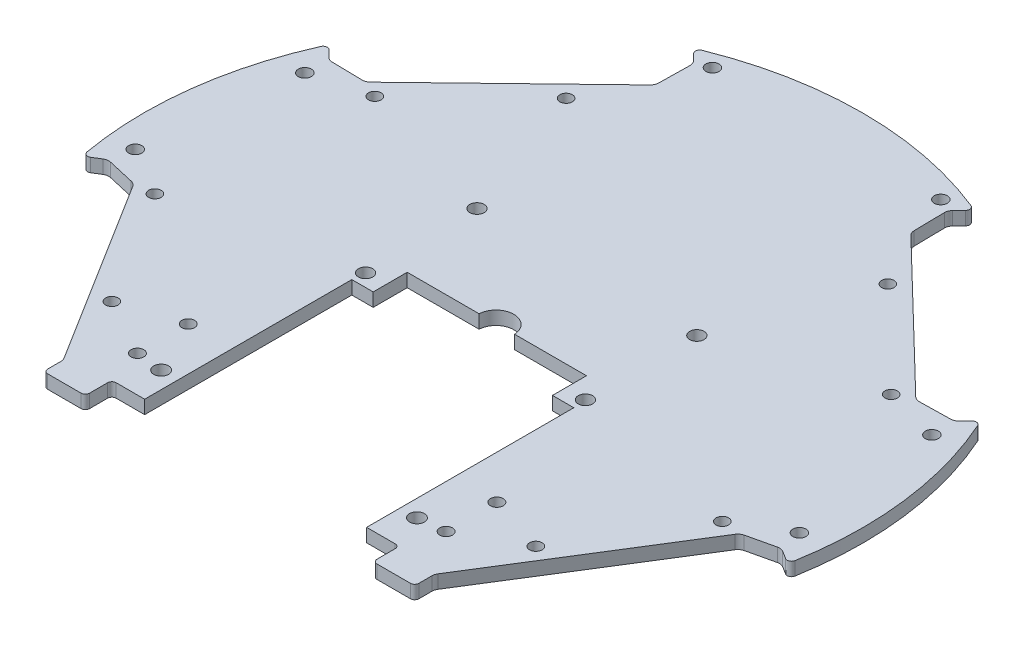
from build123d import *

# Parameters (mm, degrees)
BOSS_EXTRUDE4_DEPTH  = 1.5875
M3_CLEARANCE_HOLE3_D = 3
M3_CLEARANCE_HOLE1_D = 3.1
M3_CLEARANCE_HOLE4_D = 2.95
M3_CLEARANCE_HOLE2_D = 3.1
BOSS_EXTRUDE6_DEPTH  = 3.175
FILLET1_R            = 2
FILLET3_R            = 1
FILLET6_R            = 0.5
CUT_EXTRUDE4_DEPTH   = 10
SKETCH29_R           = 1.75
CUT_EXTRUDE5_DEPTH   = 10
SKETCH31_R           = 1.7
CUT_EXTRUDE7_DEPTH   = 10


with BuildPart() as part:
    # Sketch1 → Boss-Extrude4 (new, symmetric)
    with BuildSketch(Plane(origin=(0, 0, 0), x_dir=(1, 0, 0), z_dir=(0, 1, 0))):
        with BuildLine():
            Line((-62.799553621, 32.496136604), (-73.969425011, 32.691107434))
            Line((-73.969425011, 32.691107434), (-77.053684287, 35.88495141))
            ThreePointArc((-77.053684287, 35.88495141), (-84.36642289, 10.358894189), (-83.446216027, -16.178041625))
            Line((-83.446216027, -16.178041625), (-79.680911643, -13.825218315))
            Line((-79.680911643, -13.825218315), (-69.484649137, -16.179210996))
            Line((-69.484649137, -16.179210996), (-43.894490772, -57.132025032))
            Line((-43.894490772, -57.132025032), (-43.894490772, -64.826600275))
            Line((-43.894490772, -64.826600275), (-43.094490772, -64.826600275))
            Line((-43.094490772, -64.826600275), (-34, -64.826600275))
            Line((-34, -64.826600275), (-34, -59.55))
            Line((-34, -59.55), (-34, -58.55))
            Line((-34, -58.55), (-20, -58.55))
            Line((-20, -58.55), (-19.859459165, -59.55))
            Line((-19.859459165, -59.55), (19.859459165, -59.55))
            Line((19.859459165, -59.55), (20, -58.55))
            Line((20, -58.55), (34, -58.55))
            Line((34, -58.55), (34, -59.55))
            Line((34, -59.55), (34, -64.826600275))
            Line((34, -64.826600275), (43.094490772, -64.826600275))
            Line((43.094490772, -64.826600275), (43.894490772, -64.826600275))
            Line((43.894490772, -64.826600275), (43.894490772, -57.132025032))
            Line((43.894490772, -57.132025032), (69.484649137, -16.179210996))
            Line((69.484649137, -16.179210996), (79.680911643, -13.825218315))
            Line((79.680911643, -13.825218315), (83.446216027, -16.178041625))
            ThreePointArc((83.446216027, -16.178041625), (84.610662337, -8.126242604), (85, 0))
            ThreePointArc((85, 0), (82.98964744, 18.377116688), (77.053684287, 35.88495141))
            Line((77.053684287, 35.88495141), (73.969425011, 32.691107434))
            Line((73.969425011, 32.691107434), (62.799553621, 32.496136604))
            Line((62.799553621, 32.496136604), (30.284668021, 63.895396642))
            Line((30.284668021, 63.895396642), (30.089697191, 75.065268032))
            Line((30.089697191, 75.065268032), (33.173956467, 78.259112008))
            ThreePointArc((33.173956467, 78.259112008), (0, 85), (-33.173956467, 78.259112008))
            Line((-33.173956467, 78.259112008), (-30.089697191, 75.065268032))
            Line((-30.089697191, 75.065268032), (-30.284668021, 63.895396642))
            Line((-30.284668021, 63.895396642), (-62.799553621, 32.496136604))
        make_face()
    extrude(amount=BOSS_EXTRUDE4_DEPTH, both=True)

    # M3 Clearance Hole3 (through all)
    with Locations(Plane(origin=(0, -1.5875, 0), x_dir=(-1, 0, 0), z_dir=(0, -1, 0))):
        with Locations((36.5, -50), (36.5, -38), (-36.5, -50), (-36.5, -38)):
            Hole(M3_CLEARANCE_HOLE3_D / 2)

    # M3 Clearance Hole1 (through all)
    with Locations(Plane(origin=(0, 1.5875, 0), x_dir=(1, 0, 0), z_dir=(0, 1, 0))):
        with Locations((-78.542321426, -8.49139241), (78.542321426, -8.49139241), (74.155025063, 27.240269049), (-74.155025063, 27.240269049)):
            Hole(M3_CLEARANCE_HOLE1_D / 2)

    # M3 Clearance Hole4 (through all)
    with Locations(Plane(origin=(0, -1.5875, 0), x_dir=(-1, 0, 0), z_dir=(0, -1, 0))):
        with Locations((-67.099301622, -15.278865202), (-50.141885166, -42.416404279), (-61.062544382, 30.698137949), (-38.043670771, 52.927205804), (50.141885166, -42.416404279), (67.099301622, -15.278865202), (38.043670771, 52.927205804), (61.062544382, 30.698137949)):
            Hole(M3_CLEARANCE_HOLE4_D / 2)

    # M3 Clearance Hole2 (through all)
    with Locations(Plane(origin=(0, 1.5875, 0), x_dir=(1, 0, 0), z_dir=(0, 1, 0))):
        with Locations((27, 76.497766718), (-27, 76.497766718)):
            Hole(M3_CLEARANCE_HOLE2_D / 2)

    # Sketch22 → Boss-Extrude6 (add)
    with BuildSketch(Plane(origin=(0, 1.5875, 0), x_dir=(1, 0, 0), z_dir=(0, 1, 0))):
        Polygon((65.061950694, 32.535626892), (30.245177733, 66.157793715), (30.284668021, 63.895396642), (62.799553621, 32.496136604), align=None)
        Polygon((-30.284668021, 63.895396642), (-30.245177733, 66.157793715), (-65.061950694, 32.535626892), (-62.799553621, 32.496136604), align=None)
        Polygon((43.894490772, -60.151352895), (71.689396914, -15.670204865), (69.484649137, -16.179210996), (43.894490772, -57.132025032), align=None)
        Polygon((-69.484649137, -16.179210996), (-71.689396914, -15.670204865), (-43.894490772, -60.151352895), (-43.894490772, -57.132025032), align=None)
    extrude(amount=-BOSS_EXTRUDE6_DEPTH)

    # Fillet1
    fillet1_edges = [part.edges().sort_by_distance(p)[0] for p in [
        (-30.245177733, 0.79375, -66.157793715),
        (-65.061950694, 0.79375, -32.535626892),
        (-71.689396914, 0.79375, 15.670204865),
        (-43.894490772, 0.79375, 60.151352895),
        (43.894490772, -0.79375, 60.151352895),
        (71.689396914, -0.79375, 15.670204865),
        (65.061950694, 0.79375, -32.535626892),
        (30.245177733, -0.79375, -66.157793715),
        (30.089697191, -0.79375, -75.065268032),
        (73.969425011, -0.79375, -32.691107434),
        (79.680911643, -0.79375, 13.825218315),
        (-79.680911643, -0.79375, 13.825218315),
        (-73.969425011, -0.79375, -32.691107434),
        (-30.089697191, -0.79375, -75.065268032),
    ]]
    fillet(fillet1_edges, radius=FILLET1_R)

    # Fillet3
    fillet3_edges = [part.edges().sort_by_distance(p)[0] for p in [
        (33.173956467, -0.79375, -78.259112008),
        (77.053684287, 0.79375, -35.88495141),
        (83.446216027, -0.79375, 16.178041625),
        (43.894490772, -0.79375, 64.826600275),
        (34, 0.79375, 64.826600275),
        (34, -0.79375, 58.55),
        (-34, -0.79375, 58.55),
        (-34, 0.79375, 64.826600275),
        (-43.894490772, -0.79375, 64.826600275),
        (-83.446216027, -0.79375, 16.178041625),
        (-77.053684287, -0.79375, -35.88495141),
        (-33.173956467, -0.79375, -78.259112008),
    ]]
    fillet(fillet3_edges, radius=FILLET3_R - 0.0001)  # a hair under: the kernel refuses the full size

    # Fillet6
    fillet6_edges = [part.edges().sort_by_distance(p)[0] for p in [
        (20, -0.79375, 58.55),
        (19.859459165, -0.79375, 59.55),
        (-19.859459165, 0.79375, 59.55),
        (-20, 0.79375, 58.55),
    ]]
    fillet(fillet6_edges, radius=FILLET6_R)

    # Sketch28 → Cut-Extrude4 (cut)
    with BuildSketch(Plane(origin=(0, 1.5875, 0), x_dir=(1, 0, 0), z_dir=(0, 1, 0))):
        with BuildLine():
            Line((-26.25, -9.55), (-26.25, -59.55))
            Line((-26.25, -59.55), (26.25, -59.55))
            Line((26.25, -59.55), (26.25, -9.55))
            Line((26.25, -9.55), (21.2, -9.55))
            Line((21.2, -9.55), (21.2, -1.5))
            Line((21.2, -1.5), (4.195235393, -1.5))
            ThreePointArc((4.195235393, -1.5), (0, 2.5), (-4.195235393, -1.5))
            Line((-4.195235393, -1.5), (-21.2, -1.5))
            Line((-21.2, -1.5), (-21.2, -9.55))
            Line((-21.2, -9.55), (-26.25, -9.55))
        make_face()
    extrude(amount=-CUT_EXTRUDE4_DEPTH, mode=Mode.SUBTRACT)

    # Sketch29 → Cut-Extrude5 (cut)
    with BuildSketch(Plane(origin=(0, 1.5875, 0), x_dir=(1, 0, 0), z_dir=(0, 1, 0))):
        with Locations(Location((30.25, -50.65, 0), (0, 0, 270))):
            Circle(SKETCH29_R)
        with Locations(Location((-30.25, -50.65, 0), (0, 0, 270))):
            Circle(SKETCH29_R)
    extrude(amount=-CUT_EXTRUDE5_DEPTH, mode=Mode.SUBTRACT)

    # Sketch31 → Cut-Extrude7 (cut)
    with BuildSketch(Plane(origin=(0, 1.5875, 0), x_dir=(1, 0, 0), z_dir=(0, 1, 0))):
        with Locations(Location((-26, -6.55, 0), (0, 0, 270))):
            Circle(SKETCH31_R)
        with Locations(Location((26, -6.55, 0), (0, 0, 270))):
            Circle(SKETCH31_R)
        with Locations(Location((-26, 19.8, 0), (0, 0, 270))):
            Circle(SKETCH31_R)
        with Locations(Location((26, 19.8, 0), (0, 0, 270))):
            Circle(SKETCH31_R)
    extrude(amount=-CUT_EXTRUDE7_DEPTH, mode=Mode.SUBTRACT)


solid = part.part
